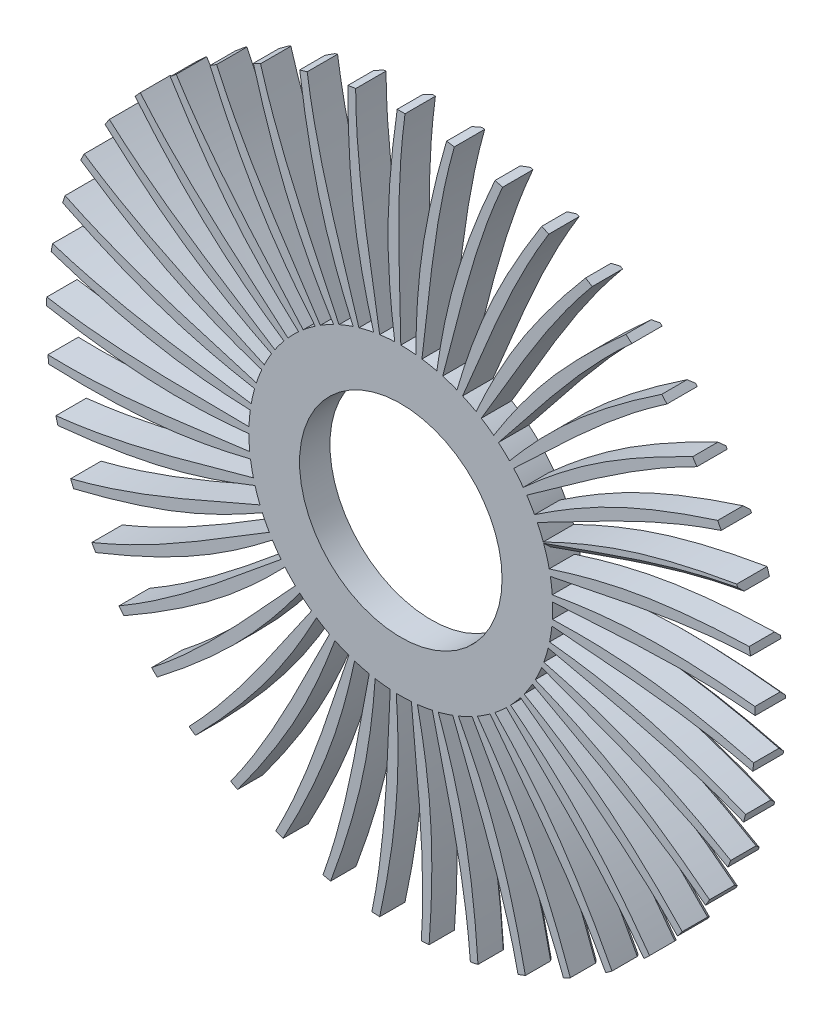
from build123d import *

# Parameters (mm, degrees)
BOSS_EXTRUDE1_DEPTH = 30
CHAMFER1_SIZE       = 5
SKETCH4_R           = 100
CUT_EXTRUDE4_DEPTH  = 30


with BuildPart() as part:
    # Sketch2 → Boss-Extrude1 (new body)
    with BuildSketch(Plane.XY):
        with BuildLine():
            ThreePointArc((292.471479946, 192.250964675), (290.334979537, 195.462527501), (288.163215232, 198.650349577))
            add(Edge.make_bspline(
                [(120.900954128, 88.786030945), (165.635643742, 128.877905167), (205.732962325, 155.615852159), (264.108901017, 186.839756211), (279.135221933, 194.356114053), (288.163215232, 198.650349577)],
                knots=[0, 0, 0, 0, 0.599000586, 0.678632802, 0.796322158, 0.796322158, 0.796322158, 0.796322158], degree=3))
            ThreePointArc((120.900954128, 88.786030945), (116.330606807, 94.69524761), (111.471723822, 100.369590954))
            add(Edge.make_bspline(
                [(111.471723822, 100.369590954), (161.000631692, 146.855251138), (204.233931026, 191.08910724), (262.869004692, 231.084154308)],
                knots=[0, 0, 0, 0, 0.813786312, 0.813786312, 0.813786312, 0.813786312], degree=3))
            ThreePointArc((262.869004692, 231.084154308), (260.3063334, 233.967119039), (257.712045473, 236.821666277))
            add(Edge.make_bspline(
                [(107.367727105, 104.74813209), (146.087351336, 150.675700422), (182.073242575, 182.73390372), (235.535543093, 221.778299293), (249.369554058, 231.312768135), (257.712045473, 236.821666277)],
                knots=[0, 0, 0, 0, 0.599000586, 0.678632802, 0.796322158, 0.796322158, 0.796322158, 0.796322158], degree=3))
            ThreePointArc((107.367727105, 104.74813209), (102.019454082, 109.963771256), (96.418141453, 114.906666468))
            add(Edge.make_bspline(
                [(96.418141453, 114.906666468), (138.995483919, 167.833023098), (175.651876835, 217.653310687), (228.15008327, 265.419553733)],
                knots=[0, 0, 0, 0, 0.813786312, 0.813786312, 0.813786312, 0.813786312], degree=3))
            ThreePointArc((228.15008327, 265.419553733), (225.211120578, 267.917806739), (222.244803891, 270.383518624))
            add(Edge.make_bspline(
                [(91.744709403, 118.671429993), (123.695634808, 169.54076456), (154.869674263, 206.295247701), (202.377753741, 252.400180048), (214.750191467, 263.7671823), (222.244803891, 270.383518624)],
                knots=[0, 0, 0, 0, 0.599000586, 0.678632802, 0.796322158, 0.796322158, 0.796322158, 0.796322158], degree=3))
            ThreePointArc((91.744709403, 118.671429993), (85.722608729, 123.091975176), (79.487889635, 127.207214423))
            add(Edge.make_bspline(
                [(79.487889635, 127.207214423), (114.284947156, 185.54411617), (143.650958661, 239.981140018), (188.990479995, 294.588863454)],
                knots=[0, 0, 0, 0, 0.813786312, 0.813786312, 0.813786312, 0.813786312], degree=3))
            ThreePointArc((188.990479995, 294.588863454), (185.732429468, 296.653779082), (182.451820002, 298.682663337))
            add(Edge.make_bspline(
                [(74.33598529, 130.284923498), (98.89632345, 185.105910565), (124.651743903, 225.841289343), (165.280911613, 278.1093784), (175.950960673, 291.087668292), (182.451820002, 298.682663337)],
                knots=[0, 0, 0, 0, 0.599000586, 0.678632802, 0.796322158, 0.796322158, 0.796322158, 0.796322158], degree=3))
            ThreePointArc((74.33598529, 130.284923498), (67.757270305, 133.824333814), (61.010496461, 137.031818646))
            add(Edge.make_bspline(
                [(61.010496461, 137.031818646), (87.349983894, 199.643804075), (108.854037978, 257.638009432), (146.152392, 318.024336039)],
                knots=[0, 0, 0, 0, 0.813786312, 0.813786312, 0.813786312, 0.813786312], degree=3))
            ThreePointArc((146.152392, 318.024336039), (142.638667885, 319.615723055), (139.107618972, 321.168289755))
            add(Edge.make_bspline(
                [(55.480395779, 139.362569165), (72.172107649, 197.068180576), (92.007609137, 240.991587179), (124.967064545, 298.405494046), (133.727044572, 312.742463927), (139.107618972, 321.168289755)],
                knots=[0, 0, 0, 0, 0.599000586, 0.678632802, 0.796322158, 0.796322158, 0.796322158, 0.796322158], degree=3))
            ThreePointArc((55.480395779, 139.362569165), (48.473113687, 141.951954018), (41.345603373, 144.189254391))
            add(Edge.make_bspline(
                [(41.345603373, 144.189254391), (58.714852555, 209.857652425), (71.938397266, 270.280248052), (100.46961394, 335.269826669)],
                knots=[0, 0, 0, 0, 0.813786312, 0.813786312, 0.813786312, 0.813786312], degree=3))
            ThreePointArc((100.46961394, 335.269826669), (96.768606882, 336.356710535), (93.055846372, 337.402740736))
            add(Edge.make_bspline(
                [(35.544943473, 145.727680945), (44.043143868, 205.194742614), (57.572650917, 251.451257894), (82.220875713, 312.893486181), (88.90028366, 328.310083242), (93.055846372, 337.402740736)],
                knots=[0, 0, 0, 0, 0.599000586, 0.678632802, 0.796322158, 0.796322158, 0.796322158, 0.796322158], degree=3))
            ThreePointArc((35.544943473, 145.727680945), (28.245483049, 147.316640904), (20.875965144, 148.540210311))
            add(Edge.make_bspline(
                [(20.875965144, 148.540210311), (28.936903398, 215.98686028), (33.622557479, 277.661789083), (52.831309128, 345.989671487)],
                knots=[0, 0, 0, 0, 0.813786312, 0.813786312, 0.813786312, 0.813786312], degree=3))
            ThreePointArc((52.831309128, 345.989671487), (49.015055018, 346.550897245), (45.192847571, 347.070031159))
            add(Edge.make_bspline(
                [(14.917649274, 149.256369178), (15.056930389, 209.327422392), (22.017106534, 257.016715896), (37.874351061, 321.291362519), (42.343179849, 337.487520234), (45.192847571, 347.070031159)],
                knots=[0, 0, 0, 0, 0.599000586, 0.678632802, 0.796322158, 0.796322158, 0.796322158, 0.796322158], degree=3))
            ThreePointArc((14.917649274, 149.256369178), (7.468086212, 149.813976946), (0, 150))
            add(Edge.make_bspline(
                [(0, 150), (-1.404269669, 217.912129581), (-5.347707144, 279.638959226), (4.164702978, 349.975220907)],
                knots=[0, 0, 0, 0, 0.813786312, 0.813786312, 0.813786312, 0.813786312], degree=3))
            ThreePointArc((4.164702978, 349.975220907), (0.307480862, 349.999864936), (-3.549778602, 349.981998211))
            add(Edge.make_bspline(
                [(-6, 149.879951962), (-14.222349113, 209.385782), (-13.966975783, 257.579635876), (-7.209354754, 323.435667949), (-5.038085793, 340.09614653), (-3.549778602, 349.981998211)],
                knots=[0, 0, 0, 0, 0.599000586, 0.678632802, 0.796322158, 0.796322158, 0.796322158, 0.796322158], degree=3))
            ThreePointArc((-6, 149.879951962), (-13.454668429, 149.395354337), (-20.875965144, 148.540210311))
            add(Edge.make_bspline(
                [(-20.875965144, 148.540210311), (-31.718110224, 215.595987151), (-44.213884731, 276.173275111), (-44.582964378, 347.148900743)],
                knots=[0, 0, 0, 0, 0.813786312, 0.813786312, 0.813786312, 0.813786312], degree=3))
            ThreePointArc((-44.582964378, 347.148900743), (-48.40607806, 346.636483375), (-52.223312372, 346.081963767))
            add(Edge.make_bspline(
                [(-26.800866099, 147.586291966), (-43.224806767, 205.368685534), (-49.679206803, 253.129061235), (-52.152738678, 319.284666005), (-52.321290825, 336.085188188), (-52.223312372, 346.081963767)],
                knots=[0, 0, 0, 0, 0.599000586, 0.678632802, 0.796322158, 0.796322158, 0.796322158, 0.796322158], degree=3))
            ThreePointArc((-26.800866099, 147.586291966), (-34.115543253, 146.068921091), (-41.345603373, 144.189254391))
            add(Edge.make_bspline(
                [(-41.345603373, 144.189254391), (-61.414593842, 209.083514068), (-82.219489343, 267.332192339), (-92.462875045, 337.565722102)],
                knots=[0, 0, 0, 0, 0.813786312, 0.813786312, 0.813786312, 0.813786312], degree=3))
            ThreePointArc((-92.462875045, 337.565722102), (-96.177467733, 336.526216958), (-99.880378769, 335.445837561))
            add(Edge.make_bspline(
                [(-47.080083824, 142.420032675), (-71.385942725, 197.354321208), (-84.424488573, 243.751617347), (-96.081028868, 308.919151218), (-98.586121446, 325.53271395), (-99.880378769, 335.445837561)],
                knots=[0, 0, 0, 0, 0.599000586, 0.678632802, 0.796322158, 0.796322158, 0.796322158, 0.796322158], degree=3))
            ThreePointArc((-47.080083824, 142.420032675), (-54.112397833, 139.899422446), (-61.010496461, 137.031818646))
            add(Edge.make_bspline(
                [(-61.010496461, 137.031818646), (-89.915712249, 198.501468213), (-118.624785119, 253.287792528), (-138.543101024, 321.412210656)],
                knots=[0, 0, 0, 0, 0.813786312, 0.813786312, 0.813786312, 0.813786312], degree=3))
            ThreePointArc((-138.543101024, 321.412210656), (-142.076872397, 319.865850521), (-145.593387207, 318.28063969))
            add(Edge.make_bspline(
                [(-66.442941271, 134.481729448), (-98.157632508, 185.498679506), (-117.526543704, 229.629825492), (-138.13921112, 292.540876543), (-142.932085354, 308.644115722), (-145.593387207, 318.28063969)],
                knots=[0, 0, 0, 0, 0.599000586, 0.678632802, 0.796322158, 0.796322158, 0.796322158, 0.796322158], degree=3))
            ThreePointArc((-66.442941271, 134.481729448), (-73.056016141, 131.006940677), (-79.487889635, 127.207214423))
            add(Edge.make_bspline(
                [(-79.487889635, 127.207214423), (-116.666723594, 184.055817071), (-152.721184386, 234.313433947), (-181.926743132, 299.00277613)],
                knots=[0, 0, 0, 0, 0.813786312, 0.813786312, 0.813786312, 0.813786312], degree=3))
            ThreePointArc((-181.926743132, 299.00277613), (-185.21091235, 296.979659146), (-188.472585972, 294.920471207))
            add(Edge.make_bspline(
                [(-84.512562444, 123.925892328), (-123.018795627, 170.03251701), (-148.341078346, 211.038550283), (-177.50867076, 270.468626466), (-184.496038803, 285.748110859), (-188.472585972, 294.920471207)],
                knots=[0, 0, 0, 0, 0.599000586, 0.678632802, 0.796322158, 0.796322158, 0.796322158, 0.796322158], degree=3))
            ThreePointArc((-84.512562444, 123.925892328), (-90.577682196, 119.564557826), (-96.418141453, 114.906666468))
            add(Edge.make_bspline(
                [(-96.418141453, 114.906666468), (-141.146949872, 166.02772881), (-183.845039517, 210.778430902), (-221.769388123, 270.773592677)],
                knots=[0, 0, 0, 0, 0.813786312, 0.813786312, 0.813786312, 0.813786312], degree=3))
            ThreePointArc((-221.769388123, 270.773592677), (-224.740032568, 268.313096515), (-227.683380236, 265.820011219))
            add(Edge.make_bspline(
                [(-100.93724272, 110.957978677), (-145.48553782, 151.256864979), (-176.268322634, 188.339649745), (-213.423126036, 243.132012229), (-222.468986717, 257.290344052), (-227.683380236, 265.820011219)],
                knots=[0, 0, 0, 0, 0.599000586, 0.678632802, 0.796322158, 0.796322158, 0.796322158, 0.796322158], degree=3))
            ThreePointArc((-100.93724272, 110.957978677), (-106.336356696, 105.794986859), (-111.471723822, 100.369590954))
            add(Edge.make_bspline(
                [(-111.471723822, 100.369590954), (-162.879911322, 144.768099662), (-211.390560074, 183.140865456), (-257.295544234, 237.274109244)],
                knots=[0, 0, 0, 0, 0.813786312, 0.813786312, 0.813786312, 0.813786312], degree=3))
            ThreePointArc((-257.295544234, 237.274109244), (-259.89484369, 234.424124661), (-262.462576489, 231.545667078))
            add(Edge.make_bspline(
                [(-115.397294381, 95.830394184), (-165.120569508, 129.537170123), (-200.764704524, 161.974932159), (-245.183542929, 211.063109932), (-256.11182886, 223.824713361), (-262.462576489, 231.545667078)],
                knots=[0, 0, 0, 0, 0.599000586, 0.678632802, 0.796322158, 0.796322158, 0.796322158, 0.796322158], degree=3))
            ThreePointArc((-115.397294381, 95.830394184), (-120.02531497, 89.966236813), (-124.355635883, 83.878935521))
            add(Edge.make_bspline(
                [(-124.355635883, 83.878935521), (-181.442600572, 120.690724125), (-234.821603833, 151.938671383), (-287.813735245, 199.156355169)],
                knots=[0, 0, 0, 0, 0.813786312, 0.813786312, 0.813786312, 0.813786312], degree=3))
            ThreePointArc((-287.813735245, 199.156355169), (-289.991097306, 195.972353875), (-292.133237238, 192.764549907))
            add(Edge.make_bspline(
                [(-127.61126897, 78.837580074), (-181.541717132, 105.296181597), (-221.353429806, 132.457556761), (-272.171741051, 174.886104282), (-284.769745577, 186.002589222), (-292.133237238, 192.764549907)],
                knots=[0, 0, 0, 0, 0.599000586, 0.678632802, 0.796322158, 0.796322158, 0.796322158, 0.796322158], degree=3))
            ThreePointArc((-127.61126897, 78.837580074), (-131.378117014, 72.386396303), (-134.819106945, 65.755672018))
            add(Edge.make_bspline(
                [(-134.819106945, 65.755672018), (-196.473715989, 94.264240926), (-253.682112179, 117.7791639), (-312.729959283, 157.162249178)],
                knots=[0, 0, 0, 0, 0.813786312, 0.813786312, 0.813786312, 0.813786312], degree=3))
            ThreePointArc((-312.729959283, 157.162249178), (-314.443004073, 153.706204136), (-316.117856821, 150.231490038))
            add(Edge.make_bspline(
                [(-137.341435363, 60.310282144), (-194.429361732, 79.00572267), (-237.633762364, 100.36204569), (-293.862425824, 135.305139541), (-307.884943117, 144.560136258), (-316.117856821, 150.231490038)],
                knots=[0, 0, 0, 0, 0.599000586, 0.678632802, 0.796322158, 0.796322158, 0.796322158, 0.796322158], degree=3))
            ThreePointArc((-137.341435363, 60.310282144), (-140.173793452, 53.397636927), (-142.658477444, 46.352549156))
            add(Edge.make_bspline(
                [(-142.658477444, 46.352549156), (-207.68069401, 66.003011502), (-267.60498677, 81.327218963), (-331.559250389, 112.109158776)],
                knots=[0, 0, 0, 0, 0.813786312, 0.813786312, 0.813786312, 0.813786312], degree=3))
            ThreePointArc((-331.559250389, 112.109158776), (-332.774635439, 108.448337971), (-333.949601899, 104.774345102))
            add(Edge.make_bspline(
                [(-144.398406941, 40.609113174), (-203.532659967, 51.177507218), (-249.288824041, 66.313101559), (-309.833412743, 93.090614166), (-325.007510454, 100.303984677), (-333.949601899, 104.774345102)],
                knots=[0, 0, 0, 0, 0.599000586, 0.678632802, 0.796322158, 0.796322158, 0.796322158, 0.796322158], degree=3))
            ThreePointArc((-144.398406941, 40.609113174), (-146.241146445, 33.369553287), (-147.721162952, 26.04722665))
            add(Edge.make_bspline(
                [(-147.721162952, 26.04722665), (-214.845403556, 36.457108536), (-276.31923469, 43.292332218), (-343.935117829, 64.873991121)],
                knots=[0, 0, 0, 0, 0.813786312, 0.813786312, 0.813786312, 0.813786312], degree=3))
            ThreePointArc((-343.935117829, 64.873991121), (-344.629187051, 61.079648266), (-345.281397838, 57.277886717))
            add(Edge.make_bspline(
                [(-148.644827779, 20.117534009), (-208.67442649, 22.353179801), (-256.091762321, 30.973448337), (-319.773844712, 49.064185876), (-335.804176289, 54.095530128), (-345.281397838, 57.277886717)],
                knots=[0, 0, 0, 0, 0.599000586, 0.678632802, 0.796322158, 0.796322158, 0.796322158, 0.796322158], degree=3))
            ThreePointArc((-148.644827779, 20.117534009), (-149.462081869, 12.69196925), (-149.908624053, 5.234924505))
            add(Edge.make_bspline(
                [(-149.908624053, 5.234924505), (-217.828391704, 6.201609422), (-279.655243015, 4.41480947), (-349.616679421, 16.376125021)],
                knots=[0, 0, 0, 0, 0.813786312, 0.813786312, 0.813786312, 0.813786312], degree=3))
            ThreePointArc((-349.616679421, 16.376125021), (-349.775923548, 12.522112684), (-349.892684121, 8.66657942))
            add(Edge.make_bspline(
                [(-149.998046125, -0.765610073), (-209.754582665, -6.906226834), (-257.910165746, -4.969067826), (-323.490242531, 4.082779017), (-340.064795805, 6.834167618), (-349.892684121, 8.66657942)],
                knots=[0, 0, 0, 0, 0.599000586, 0.678632802, 0.796322158, 0.796322158, 0.796322158, 0.796322158], degree=3))
            ThreePointArc((-149.998046125, -0.765610073), (-149.77390788, -8.232649532), (-149.178284305, -15.67926949))
            add(Edge.make_bspline(
                [(-149.178284305, -15.67926949), (-216.571597984, -24.174596965), (-277.548080138, -34.548642524), (-348.493350031, -32.440483725)],
                knots=[0, 0, 0, 0, 0.813786312, 0.813786312, 0.813786312, 0.813786312], degree=3))
            ThreePointArc((-348.493350031, -32.440483725), (-348.114669557, -36.279151578), (-347.693707303, -40.113412988))
            add(Edge.make_bspline(
                [(-148.431723123, -21.633852425), (-206.752104481, -36.031211619), (-254.708641164, -40.814866735), (-320.910270745, -40.978094491), (-337.706440889, -40.560214192), (-347.693707303, -40.113412988)],
                knots=[0, 0, 0, 0, 0.599000586, 0.678632802, 0.796322158, 0.796322158, 0.796322158, 0.796322158], degree=3))
            ThreePointArc((-148.431723123, -21.633852425), (-147.17055514, -28.997029155), (-145.544358941, -36.28828434))
            add(Edge.make_bspline(
                [(-145.544358941, -36.28828434), (-211.099484456, -54.080272321), (-270.038759587, -72.839644488), (-340.586993987, -80.625675356)],
                knots=[0, 0, 0, 0, 0.813786312, 0.813786312, 0.813786312, 0.813786312], degree=3))
            ThreePointArc((-340.586993987, -80.625675356), (-339.677759498, -84.37428342), (-338.727267969, -88.11264344))
            add(Edge.make_bspline(
                [(-143.976345469, -42.081016449), (-199.72543176, -64.454889855), (-246.549502609, -75.86625069), (-312.084145568, -85.241376002), (-328.775014236, -87.165137568), (-338.727267969, -88.11264344)],
                knots=[0, 0, 0, 0, 0.599000586, 0.678632802, 0.796322158, 0.796322158, 0.796322158, 0.796322158], degree=3))
            ThreePointArc((-143.976345469, -42.081016449), (-141.702694948, -49.19701459), (-139.077578185, -56.190989012))
            add(Edge.make_bspline(
                [(-139.077578185, -56.190989012), (-201.518559585, -82.933336691), (-257.273441746, -109.712905626), (-326.051499518, -127.241579925)],
                knots=[0, 0, 0, 0, 0.813786312, 0.813786312, 0.813786312, 0.813786312], degree=3))
            ThreePointArc((-326.051499518, -127.241579925), (-324.629408227, -130.82716581), (-323.167887661, -134.396861514))
            add(Edge.make_bspline(
                [(-136.718632022, -61.709121353), (-188.811330695, -91.624026976), (-233.591558431, -109.440984372), (-297.183657488, -127.845531089), (-313.444355907, -132.07349069), (-323.167887661, -134.396861514)],
                knots=[0, 0, 0, 0, 0.599000586, 0.678632802, 0.796322158, 0.796322158, 0.796322158, 0.796322158], degree=3))
            ThreePointArc((-136.718632022, -61.709121353), (-133.476752983, -68.439436096), (-129.903810568, -75))
            add(Edge.make_bspline(
                [(-129.903810568, -75), (-188.015305176, -110.172197998), (-239.500589005, -144.450729853), (-305.169783489, -171.380871877)],
                knots=[0, 0, 0, 0, 0.813786312, 0.813786312, 0.813786312, 0.813786312], degree=3))
            ThreePointArc((-305.169783489, -171.380871877), (-303.262514786, -174.733646232), (-301.318412017, -178.065197553))
            add(Edge.make_bspline(
                [(-126.799845917, -80.136128403), (-174.222231847, -117.009806633), (-216.087020274, -140.88557378), (-276.498827557, -167.961318336), (-292.012859728, -174.411183548), (-301.318412017, -178.065197553)],
                knots=[0, 0, 0, 0, 0.599000586, 0.678632802, 0.796322158, 0.796322158, 0.796322158, 0.796322158], degree=3))
            ThreePointArc((-126.799845917, -80.136128403), (-122.652837849, -86.349761827), (-118.201613041, -92.349221299))
            add(Edge.make_bspline(
                [(-118.201613041, -92.349221299), (-170.852546715, -135.266682789), (-217.066129727, -176.376984933), (-278.34828475, -212.1844301)],
                knots=[0, 0, 0, 0, 0.813786312, 0.813786312, 0.813786312, 0.813786312], degree=3))
            ThreePointArc((-278.34828475, -212.1844301), (-275.992961451, -215.239134986), (-273.604116228, -218.267697067))
            add(Edge.make_bspline(
                [(-114.413045044, -97.003376868), (-156.242095431, -140.118123501), (-194.376594064, -169.587985749), (-250.43226246, -204.807929575), (-264.897665394, -213.354161108), (-273.604116228, -218.267697067)],
                knots=[0, 0, 0, 0, 0.599000586, 0.678632802, 0.796322158, 0.796322158, 0.796322158, 0.796322158], degree=3))
            ThreePointArc((-114.413045044, -97.003376868), (-109.441624742, -102.579387666), (-104.198755569, -107.900970051))
            add(Edge.make_bspline(
                [(-104.198755569, -107.900970051), (-150.364337775, -157.728355464), (-190.406725142, -204.870262627), (-246.109053264, -248.858059748)],
                knots=[0, 0, 0, 0, 0.813786312, 0.813786312, 0.813786312, 0.813786312], degree=3))
            ThreePointArc((-246.109053264, -248.858059748), (-243.351519058, -251.555238808), (-240.564427537, -254.221864134))
            add(Edge.make_bspline(
                [(-99.799324392, -111.982564942), (-135.22088435, -160.499200477), (-168.88284855, -194.98956048), (-219.491318237, -237.66818743), (-232.62653932, -248.144442608), (-240.564427537, -254.221864134)],
                knots=[0, 0, 0, 0, 0.599000586, 0.678632802, 0.796322158, 0.796322158, 0.796322158, 0.796322158], degree=3))
            ThreePointArc((-99.799324392, -111.982564942), (-94.100254897, -116.812422406), (-88.167787844, -121.352549156))
            add(Edge.make_bspline(
                [(-88.167787844, -121.352549156), (-126.949458037, -177.120025113), (-160.041270238, -229.375973696), (-209.079589002, -280.687950334)],
                knots=[0, 0, 0, 0, 0.813786312, 0.813786312, 0.813786312, 0.813786312], degree=3))
            ThreePointArc((-209.079589002, -280.687950334), (-205.973516156, -282.975106047), (-202.842425901, -285.227891789))
            add(Edge.make_bspline(
                [(-83.243123411, -124.782139767), (-111.567752567, -177.75634308), (-140.10199049, -216.595885213), (-184.278225171, -265.902504361), (-195.827602267, -278.104874793), (-202.842425901, -285.227891789)],
                knots=[0, 0, 0, 0, 0.599000586, 0.678632802, 0.796322158, 0.796322158, 0.796322158, 0.796322158], degree=3))
            ThreePointArc((-83.243123411, -124.782139767), (-76.927330628, -128.771836216), (-70.420734418, -132.442138929))
            add(Edge.make_bspline(
                [(-70.420734418, -132.442138929), (-101.063651501, -193.064254944), (-126.560794052, -249.417142349), (-167.980628364, -307.054569245)],
                knots=[0, 0, 0, 0, 0.813786312, 0.813786312, 0.813786312, 0.813786312], degree=3))
            ThreePointArc((-167.980628364, -307.054569245), (-164.586473052, -308.887184726), (-161.172327175, -310.682282972))
            add(Edge.make_bspline(
                [(-65.066689721, -135.152972179), (-85.743081387, -191.55366066), (-108.594206549, -233.986417414), (-145.478366067, -288.961331503), (-155.217103686, -302.65231193), (-161.172327175, -310.682282972)],
                knots=[0, 0, 0, 0, 0.599000586, 0.678632802, 0.796322158, 0.796322158, 0.796322158, 0.796322158], degree=3))
            ThreePointArc((-65.066689721, -135.152972179), (-58.257103372, -138.22485271), (-51.303021499, -140.953893118))
            add(Edge.make_bspline(
                [(-51.303021499, -140.953893118), (-73.210755946, -205.250708661), (-90.616955972, -264.603690033), (-123.61211587, -327.444720235)],
                knots=[0, 0, 0, 0, 0.813786312, 0.813786312, 0.813786312, 0.813786312], degree=3))
            ThreePointArc((-123.61211587, -327.444720235), (-119.995941465, -328.787125709), (-116.365192432, -330.089596913))
            add(Edge.make_bspline(
                [(-45.623806927, -142.893205722), (-58.249518658, -201.622604125), (-74.972759902, -246.822670156), (-103.846936046, -306.395855017), (-111.585480739, -321.308966077), (-116.365192432, -330.089596913)],
                knots=[0, 0, 0, 0, 0.599000586, 0.678632802, 0.796322158, 0.796322158, 0.796322158, 0.796322158], degree=3))
            ThreePointArc((-45.623806927, -142.893205722), (-38.452967865, -144.987479675), (-31.186753623, -146.72214011))
            add(Edge.make_bspline(
                [(-31.186753623, -146.72214011), (-43.932896304, -213.442190802), (-52.909361918, -274.640027873), (-76.837634148, -341.461532209)],
                knots=[0, 0, 0, 0, 0.813786312, 0.813786312, 0.813786312, 0.813786312], degree=3))
            ThreePointArc((-76.837634148, -341.461532209), (-73.069825371, -342.287599279), (-69.293141581, -343.072092321))
            add(Edge.make_bspline(
                [(-25.292908628, -147.852185554), (-29.622195307, -207.767192943), (-39.892053764, -254.85480038), (-60.194243539, -317.866731733), (-65.781973335, -333.711706683), (-69.293141581, -343.072092321)],
                knots=[0, 0, 0, 0, 0.599000586, 0.678632802, 0.796322158, 0.796322158, 0.796322158, 0.796322158], degree=3))
            ThreePointArc((-25.292908628, -147.852185554), (-17.900389078, -148.928090268), (-10.463471062, -149.634607539))
            add(Edge.make_bspline(
                [(-10.463471062, -149.634607539), (-13.799932807, -217.479263486), (-14.171947318, -279.330809969), (-28.567595278, -348.832183865)],
                knots=[0, 0, 0, 0, 0.813786312, 0.813786312, 0.813786312, 0.813786312], degree=3))
            ThreePointArc((-28.567595278, -348.832183865), (-24.721488242, -349.125834076), (-20.87237855, -349.377079691))
            add(Edge.make_bspline(
                [(-4.469712632, -149.933390774), (-0.418309619, -209.867829681), (-4.034894175, -257.926471808), (-15.369938551, -323.150694083), (-18.698094647, -339.61912851), (-20.87237855, -349.377079691)],
                knots=[0, 0, 0, 0, 0.599000586, 0.678632802, 0.796322158, 0.796322158, 0.796322158, 0.796322158], degree=3))
            ThreePointArc((-4.469712632, -149.933390774), (3.00060042, -149.969984987), (10.463471062, -149.634607539))
            add(Edge.make_bspline(
                [(10.463471062, -149.634607539), (16.601630684, -217.283349685), (24.841308116, -278.584735583), (20.258479338, -349.413213853)],
                knots=[0, 0, 0, 0, 0.813786312, 0.813786312, 0.813786312, 0.813786312], degree=3))
            ThreePointArc((20.258479338, -349.413213853), (24.108024536, -349.168731637), (27.954641589, -348.881839616))
            add(Edge.make_bspline(
                [(16.440481235, -149.096313089), (28.79371799, -207.883627836), (31.900800039, -255.977897849), (29.753524807, -322.144895752), (28.749721185, -338.916250311), (27.954641589, -348.881839616)],
                knots=[0, 0, 0, 0, 0.599000586, 0.678632802, 0.796322158, 0.796322158, 0.796322158, 0.796322158], degree=3))
            ThreePointArc((16.440481235, -149.096313089), (23.843186645, -148.092884537), (31.186753623, -146.72214011))
            add(Edge.make_bspline(
                [(31.186753623, -146.72214011), (46.680062318, -212.858262639), (63.371055744, -272.416326204), (68.690245698, -343.193313084)],
                knots=[0, 0, 0, 0, 0.813786312, 0.813786312, 0.813786312, 0.813786312], degree=3))
            ThreePointArc((68.690245698, -343.193313084), (72.468302039, -342.41545701), (76.237556426, -341.596011379))
            add(Edge.make_bspline(
                [(37.030679836, -145.357245264), (57.445308631, -201.85320764), (67.215581467, -249.047005279), (74.297869649, -314.868913459), (75.637956396, -331.616752812), (76.237556426, -341.596011379)],
                knots=[0, 0, 0, 0, 0.599000586, 0.678632802, 0.796322158, 0.796322158, 0.796322158, 0.796322158], degree=3))
            ThreePointArc((37.030679836, -145.357245264), (44.221692363, -143.333324543), (51.303021499, -140.953893118))
            add(Edge.make_bspline(
                [(51.303021499, -140.953893118), (75.849919637, -204.290131634), (100.667357856, -260.945642904), (115.78503456, -330.293544854)],
                knots=[0, 0, 0, 0, 0.813786312, 0.813786312, 0.813786312, 0.813786312], degree=3))
            ThreePointArc((115.78503456, -330.293544854), (119.418066474, -328.997455005), (123.036593947, -327.661405341))
            add(Edge.make_bspline(
                [(56.900118376, -138.788964002), (84.978791682, -191.893944361), (101.222088058, -237.268696038), (117.396090971, -301.464365924), (121.053984823, -317.862712427), (123.036593947, -327.661405341)],
                knots=[0, 0, 0, 0, 0.599000586, 0.678632802, 0.796322158, 0.796322158, 0.796322158, 0.796322158], degree=3))
            ThreePointArc((56.900118376, -138.788964002), (63.73947314, -135.783944426), (70.420734418, -132.442138929))
            add(Edge.make_bspline(
                [(70.420734418, -132.442138929), (103.543444548, -191.745725593), (136.004284354, -244.395949487), (160.626199427, -310.964988476)],
                knots=[0, 0, 0, 0, 0.813786312, 0.813786312, 0.813786312, 0.813786312], degree=3))
            ThreePointArc((160.626199427, -310.964988476), (164.043494081, -309.175891767), (167.440864119, -307.349242757))
            add(Edge.make_bspline(
                [(75.662060835, -129.519313426), (110.858259215, -178.199683731), (133.258421843, -220.872221518), (158.209330919, -282.192157417), (164.113835132, -297.921835909), (167.440864119, -307.349242757)],
                knots=[0, 0, 0, 0, 0.599000586, 0.678632802, 0.796322158, 0.796322158, 0.796322158, 0.796322158], degree=3))
            ThreePointArc((75.662060835, -129.519313426), (82.016637575, -125.591684282), (88.167787844, -121.352549156))
            add(Edge.make_bspline(
                [(88.167787844, -121.352549156), (129.22161409, -175.46920711), (168.69404216, -223.08936691), (202.340958032, -285.583852314)],
                knots=[0, 0, 0, 0, 0.813786312, 0.813786312, 0.813786312, 0.813786312], degree=3))
            ThreePointArc((202.340958032, -285.583852314), (205.476001672, -283.336571478), (208.586088331, -281.054876767))
            add(Edge.make_bspline(
                [(92.951327344, -117.728716739), (134.579996832, -161.036968957), (162.701032027, -200.176720444), (195.9432062, -257.427399555), (203.979396317, -272.182249736), (208.586088331, -281.054876767)],
                knots=[0, 0, 0, 0, 0.599000586, 0.678632802, 0.796322158, 0.796322158, 0.796322158, 0.796322158], degree=3))
            ThreePointArc((92.951327344, -117.728716739), (98.697441453, -112.954924862), (104.198755569, -107.900970051))
            add(Edge.make_bspline(
                [(104.198755569, -107.900970051), (152.384631901, -155.777380105), (198.100362322, -197.440603565), (240.117380048, -254.644151315)],
                knots=[0, 0, 0, 0, 0.813786312, 0.813786312, 0.813786312, 0.813786312], degree=3))
            ThreePointArc((240.117380048, -254.644151315), (242.909152616, -251.982427116), (245.671421598, -249.290097296))
            add(Edge.make_bspline(
                [(108.431401996, -103.646664496), (155.682287893, -140.739852759), (188.976851692, -175.585007205), (229.863269855, -227.652110179), (239.874730576, -241.144945674), (245.671421598, -249.290097296)],
                knots=[0, 0, 0, 0, 0.599000586, 0.678632802, 0.796322158, 0.796322158, 0.796322158, 0.796322158], degree=3))
            ThreePointArc((108.431401996, -103.646664496), (113.457211899, -98.119626314), (118.201613041, -92.349221299))
            add(Edge.make_bspline(
                [(118.201613041, -92.349221299), (172.581656187, -133.053523589), (223.650884267, -167.948883458), (273.220190391, -218.748091563)],
                knots=[0, 0, 0, 0, 0.813786312, 0.813786312, 0.813786312, 0.813786312], degree=3))
            ThreePointArc((273.220190391, -218.748091563), (275.61435321, -215.723731435), (277.97504009, -212.673169645))
            add(Edge.make_bspline(
                [(121.800982748, -87.547247825), (173.754400306, -117.703395416), (211.574451896, -147.575731525), (259.309306428, -193.44583143), (271.101176058, -205.414029543), (277.97504009, -212.673169645)],
                knots=[0, 0, 0, 0, 0.599000586, 0.678632802, 0.796322158, 0.796322158, 0.796322158, 0.796322158], degree=3))
            ThreePointArc((121.800982748, -87.547247825), (126.008666771, -81.37454085), (129.903810568, -75))
            add(Edge.make_bspline(
                [(129.903810568, -75), (189.419574844, -107.739931584), (244.848296149, -135.188229374), (301.005080512, -178.594349031)],
                knots=[0, 0, 0, 0, 0.813786312, 0.813786312, 0.813786312, 0.813786312], degree=3))
            ThreePointArc((301.005080512, -178.594349031), (302.955033926, -175.266218705), (304.868190619, -171.916800659))
            add(Edge.make_bspline(
                [(132.799845917, -69.743823558), (188.44458096, -92.375975367), (230.053996057, -116.694062096), (283.708182311, -155.474349613), (297.050945521, -165.684962982), (304.868190619, -171.916800659)],
                knots=[0, 0, 0, 0, 0.599000586, 0.678632802, 0.796322158, 0.796322158, 0.796322158, 0.796322158], degree=3))
            ThreePointArc((132.799845917, -69.743823558), (136.107506278, -63.04559251), (139.077578185, -56.190989012))
            add(Edge.make_bspline(
                [(139.077578185, -56.190989012), (202.570656939, -80.329304362), (261.280014458, -99.796290179), (322.931249129, -134.964470644)],
                knots=[0, 0, 0, 0, 0.813786312, 0.813786312, 0.813786312, 0.813786312], degree=3))
            ThreePointArc((322.931249129, -134.964470644), (324.399039512, -131.39734839), (325.8274286, -127.8142667))
            add(Edge.make_bspline(
                [(141.213911143, -50.582915098), (199.466902198, -65.250562033), (244.055800867, -83.541075486), (302.585001138, -114.47673643), (317.218956219, -122.731027081), (325.8274286, -127.8142667)],
                knots=[0, 0, 0, 0, 0.599000586, 0.678632802, 0.796322158, 0.796322158, 0.796322158, 0.796322158], degree=3))
            ThreePointArc((141.213911143, -50.582915098), (143.557167994, -43.489533425), (145.544358941, -36.28828434))
            add(Edge.make_bspline(
                [(145.544358941, -36.28828434), (211.778931617, -51.355158604), (272.626214486, -62.461929712), (338.57192831, -88.707662355)],
                knots=[0, 0, 0, 0, 0.813786312, 0.813786312, 0.813786312, 0.813786312], degree=3))
            ThreePointArc((338.57192831, -88.707662355), (339.528986792, -84.97097815), (340.444806306, -81.223973426))
            add(Edge.make_bspline(
                [(146.879408216, -30.437467733), (206.606827075, -36.855120731), (253.307337123, -48.762056868), (315.572347104, -71.250963788), (331.212660766, -77.388271342), (340.444806306, -81.223973426)],
                knots=[0, 0, 0, 0, 0.599000586, 0.678632802, 0.796322158, 0.796322158, 0.796322158, 0.796322158], degree=3))
            ThreePointArc((146.879408216, -30.437467733), (148.21265273, -23.08700004), (149.178284305, -15.67926949))
            add(Edge.make_bspline(
                [(149.178284305, -15.67926949), (216.865170285, -21.3814431), (278.666055358, -23.911818832), (347.622690026, -40.724260322)],
                knots=[0, 0, 0, 0, 0.813786312, 0.813786312, 0.813786312, 0.813786312], degree=3))
            ThreePointArc((347.622690026, -40.724260322), (348.050388553, -36.890744474), (348.435813108, -33.052747901))
            add(Edge.make_bspline(
                [(149.686064682, -9.699589681), (209.725385075, -7.742336426), (257.628534194, -13.033940279), (322.417436292, -26.638372182), (338.759687621, -30.539240929), (348.435813108, -33.052747901)],
                knots=[0, 0, 0, 0, 0.599000586, 0.678632802, 0.796322158, 0.796322158, 0.796322158, 0.796322158], degree=3))
            ThreePointArc((149.686064682, -9.699589681), (149.983346769, -2.235104461), (149.908624053, 5.234924505))
            add(Edge.make_bspline(
                [(149.908624053, 5.234924505), (217.730375095, 9.008437873), (279.281978439, 15.103708401), (349.907371497, 8.051793115)],
                knots=[0, 0, 0, 0, 0.813786312, 0.813786312, 0.813786312, 0.813786312], degree=3))
            ThreePointArc((349.907371497, 8.051793115), (349.797385403, 11.90752558), (349.644913147, 15.761811765))
            add(Edge.make_bspline(
                [(149.579252164, 11.227079851), (208.761877013, 21.521143651), (256.935284896, 22.947867131), (322.987036826, 18.492705037), (339.713142488, 16.904201071), (349.644913147, 15.761811765)],
                knots=[0, 0, 0, 0, 0.599000586, 0.678632802, 0.796322158, 0.796322158, 0.796322158, 0.796322158], degree=3))
            ThreePointArc((149.579252164, 11.227079851), (148.834785567, 18.660294884), (147.721162952, 26.04722665))
            add(Edge.make_bspline(
                [(147.721162952, 26.04722665), (214.357705818, 39.22297985), (274.461995489, 53.825259131), (345.381503994, 56.671127558)],
                knots=[0, 0, 0, 0, 0.813786312, 0.813786312, 0.813786312, 0.813786312], degree=3))
            ThreePointArc((345.381503994, 56.671127558), (344.735974034, 60.474029194), (344.048572668, 64.269585694))
            add(Edge.make_bspline(
                [(146.561049647, 31.935227045), (203.735056479, 50.365739146), (251.241082536, 58.483020411), (317.270062082, 63.263842788), (334.054467456, 64.018622025), (344.048572668, 64.269585694)],
                knots=[0, 0, 0, 0, 0.599000586, 0.678632802, 0.796322158, 0.796322158, 0.796322158, 0.796322158], degree=3))
            ThreePointArc((146.561049647, 31.935227045), (144.789324561, 39.192492815), (142.658477444, 46.352549156))
            add(Edge.make_bspline(
                [(142.658477444, 46.352549156), (206.812807626, 68.67409114), (264.299921993, 91.499162417), (334.133178382, 104.187422965)],
                knots=[0, 0, 0, 0, 0.813786312, 0.813786312, 0.813786312, 0.813786312], degree=3))
            ThreePointArc((334.133178382, 104.187422965), (332.964669062, 107.863474618), (331.75571807, 111.526425243))
            add(Edge.make_bspline(
                [(140.690203009, 52.02179137), (194.742764815, 78.230022819), (240.656758288, 92.879868222), (305.377786468, 106.8036218), (321.893802196, 109.886993322), (331.75571807, 111.526425243)],
                knots=[0, 0, 0, 0, 0.599000586, 0.678632802, 0.796322158, 0.796322158, 0.796322158, 0.796322158], degree=3))
            ThreePointArc((140.690203009, 52.02179137), (137.925704048, 58.961853455), (134.819106945, 65.755672018))
            add(Edge.make_bspline(
                [(134.819106945, 65.755672018), (195.242533379, 96.788539361), (248.993551152, 127.392138585), (316.381330524, 149.675828696)],
                knots=[0, 0, 0, 0, 0.813786312, 0.813786312, 0.813786312, 0.813786312], degree=3))
            ThreePointArc((316.381330524, 149.675828696), (314.712585548, 153.153480201), (313.005615788, 156.612529784))
            add(Edge.make_bspline(
                [(132.080981602, 71.0958107), (181.960026751, 104.571648084), (225.388323982, 125.468915047), (287.541679602, 148.264589802), (303.467840224, 153.616539288), (313.005615788, 156.612529784)],
                knots=[0, 0, 0, 0, 0.599000586, 0.678632802, 0.796322158, 0.796322158, 0.796322158, 0.796322158], degree=3))
            ThreePointArc((132.080981602, 71.0958107), (128.377516594, 77.583588684), (124.355635883, 83.878935521))
            add(Edge.make_bspline(
                [(124.355635883, 83.878935521), (179.872085305, 123.019108759), (228.840804063, 160.805571682), (292.471479946, 192.250964675)],
                knots=[0, 0, 0, 0, 0.813786312, 0.813786312, 0.813786312, 0.813786312], degree=3))
        make_face()
    extrude(amount=BOSS_EXTRUDE1_DEPTH)

    # Chamfer1
    chamfer1_edges = [part.edges().sort_by_distance(p)[0] for p in [
        (249.415527524, 21.201579452, 0),
        (244.037543198, 55.707179531, 0),
        (237.246852803, 79.199696821, 30),
        (219.228962981, 120.815040999, 0),
        (200.281237885, 150.150051924, 0),
        (177.43526631, 176.56256288, 0),
        (151.135719106, 199.538484388, 0),
        (121.894487044, 218.630616268, 0),
        (90.280717444, 233.467351891, 0),
        (56.909736373, 243.759911075, 0),
        (22.431072016, 249.307960863, 0),
        (-12.484187642, 250.003514776, 0),
        (-47.156456788, 245.833034649, 0),
        (-80.910879143, 236.877694133, 0),
        (-113.09046327, 223.311798745, 0),
        (-143.068870168, 205.399393208, 0),
        (-170.262604246, 183.489122121, 0),
        (-194.142370404, 158.007443987, 0),
        (-214.243376155, 129.450330687, 0),
        (-230.174378288, 98.373613948, 0),
        (-241.625297967, 65.382166712, 0),
        (-248.373256065, 31.118129971, 0),
        (-250.286911255, -3.751585773, 0),
        (-247.329016414, -38.548281167, 0),
        (-239.557143602, -72.594678116, 0),
        (-227.122563481, -105.228102231, 0),
        (-210.26730101, -135.813381032, 0),
        (-189.319424701, -163.755206856, 0),
        (-164.686661137, -188.509723847, 0),
        (-136.848459043, -209.59511349, 0),
        (-106.346657356, -226.60097266, 0),
        (-73.774938952, -239.196301652, 0),
        (-39.767275278, -247.135946714, 0),
        (-4.985586826, -250.265371686, 0),
        (29.893140403, -248.523665871, 0),
        (64.190031657, -241.944729592, 0),
        (97.237536959, -230.656614359, 0),
        (128.392424211, -214.879030495, 0),
        (157.04829897, -194.919070724, 0),
        (182.647407229, -171.165232959, 0),
        (204.691491465, -144.079858631, 0),
        (222.751488652, -114.190133744, 0),
        (236.475881489, -82.077827793, 0),
        (245.59754028, -48.367970286, 0),
        (249.938922313, -13.716685255, 0),
    ]]
    chamfer(chamfer1_edges, length=CHAMFER1_SIZE)

    # Sketch4 → Cut-Extrude4 (cut)
    with BuildSketch(Plane.XY.offset(30)):
        Circle(SKETCH4_R)
    extrude(amount=-CUT_EXTRUDE4_DEPTH, mode=Mode.SUBTRACT)


solid = part.part
